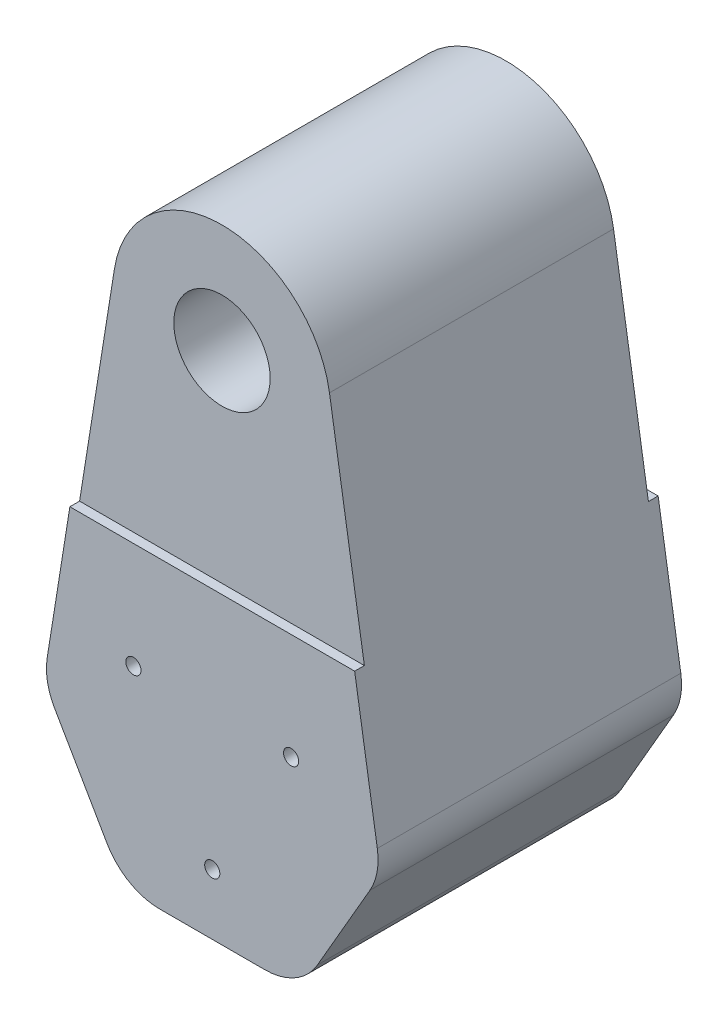
from build123d import *

# Parameters (mm, degrees)
SKETCH1_R           = 1.25
BOSS_EXTRUDE1_DEPTH = 25
SKETCH1_3_R         = 7.9375
BOSS_EXTRUDE2_DEPTH = 23.3998


with BuildPart() as part:
    # Sketch1 → Boss-Extrude1 (new, symmetric)
    with BuildSketch(Plane.XY):
        with BuildLine():
            Line((23.460328237, -33.213203436), (-23.460328237, -33.213203436))
            Line((-23.460328237, -33.213203436), (-27.195743689, -56.638490264))
            ThreePointArc((-27.195743689, -56.638490264), (-27.154012409, -60.03039702), (-25.980762114, -63.213203436))
            Line((-25.980762114, -63.213203436), (-17.320508076, -78.213203436))
            ThreePointArc((-17.320508076, -78.213203436), (-13.660254038, -81.873457473), (-8.660254038, -83.213203436))
            Line((-8.660254038, -83.213203436), (8.660254038, -83.213203436))
            ThreePointArc((8.660254038, -83.213203436), (13.660254038, -81.873457473), (17.320508076, -78.213203436))
            Line((17.320508076, -78.213203436), (25.980762114, -63.213203436))
            ThreePointArc((25.980762114, -63.213203436), (27.154012409, -60.03039702), (27.195743689, -56.638490264))
            Line((27.195743689, -56.638490264), (23.460328237, -33.213203436))
        make_face()
        with Locations((-12.990381057, -50.713203436)):
            Circle(SKETCH1_R, mode=Mode.SUBTRACT)
        with Locations((0, -73.213203436)):
            Circle(SKETCH1_R, mode=Mode.SUBTRACT)
        with Locations((12.990381057, -50.713203436)):
            Circle(SKETCH1_R, mode=Mode.SUBTRACT)
    extrude(amount=BOSS_EXTRUDE1_DEPTH, both=True)

    # Sketch1<3> → Boss-Extrude2 (add, symmetric)
    with BuildSketch(Plane.XY):
        with BuildLine():
            ThreePointArc((17.713703882, 2.824641751), (0, 17.9375), (-17.713703882, 2.824641751))
            Line((-17.713703882, 2.824641751), (-23.460328237, -33.213203436))
            Line((-23.460328237, -33.213203436), (23.460328237, -33.213203436))
            Line((23.460328237, -33.213203436), (17.713703882, 2.824641751))
        make_face()
        Circle(SKETCH1_3_R, mode=Mode.SUBTRACT)
    extrude(amount=BOSS_EXTRUDE2_DEPTH, both=True)


solid = part.part
